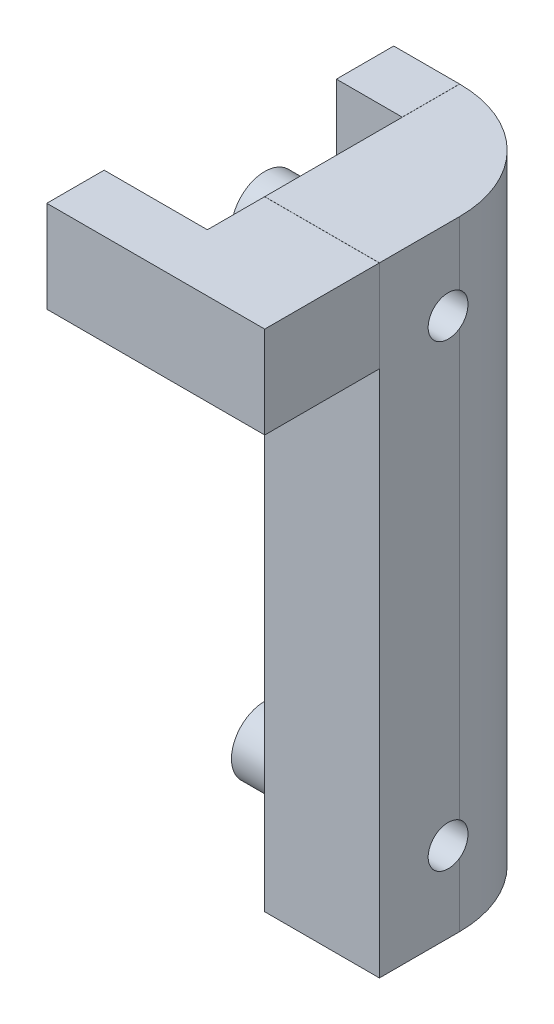
from build123d import *

# Parameters (mm, degrees)
SKETCH1_W               = 12
SKETCH1_H               = 54
BOSS_EXTRUDE1_DEPTH     = 10
SKETCH2_R               = 2.9
BOSS_EXTRUDE2_DEPTH     = 18
SKETCH3_W               = 12
SKETCH3_H               = 54
BOSS_EXTRUDE3_DEPTH     = 10
SKETCH4_R               = 1.75
CUT_EXTRUDE1_DEPTH      = 50
SKETCH5_W               = 38
SKETCH5_H               = 54
BOSS_EXTRUDE4_DEPTH     = 5
FILLET1_R               = 10
SKETCH6_W               = 6
SKETCH6_H               = 54
CUT_EXTRUDE2_DEPTH      = 15
SKETCH7_W               = 0.01
SKETCH7_H               = 54
CUT_EXTRUDE3_DEPTH      = 12.5
BOSS_EXTRUDE5_DEPTH     = 8
SKETCH9_W               = 38
SKETCH9_H               = 0.01
CUT_EXTRUDE4_DEPTH      = 50
SKETCH10_W              = 11
SKETCH10_H              = 54
BOSS_EXTRUDE6_DEPTH     = 2.5
BOSS_EXTRUDE7_DEPTH     = 54
CUT_EXTRUDE5_DEPTH      = 10
CUT_EXTRUDE5_DEPTH_BACK = 5
CUT_EXTRUDE6_DEPTH      = 67.550732692
CUT_EXTRUDE6_DEPTH_BACK = 67.550732692
SKETCH15_W              = 34.984132004
SKETCH15_H              = 56.27391211
SKETCH16_R              = 1
BOSS_EXTRUDE8_DEPTH     = 1.5


with BuildPart() as part:
    # Sketch1 → Boss-Extrude1 (new body)
    with BuildSketch(Plane(origin=(0, 0, 0), x_dir=(0, 0, -1), z_dir=(1, 0, 0))):
        with Locations((6, 27)):
            Rectangle(SKETCH1_W, SKETCH1_H)
    extrude(amount=BOSS_EXTRUDE1_DEPTH)

    # Sketch2 → Boss-Extrude2 (add)
    with BuildSketch(Plane.ZY):
        with Locations((-6, 47)):
            Circle(SKETCH2_R)
        with Locations((-6, 7)):
            Circle(SKETCH2_R)
    extrude(amount=BOSS_EXTRUDE2_DEPTH)

    # Sketch3 → Boss-Extrude3 (add)
    with BuildSketch(Plane.ZY.offset(18)):
        with Locations((-6, 27)):
            Rectangle(SKETCH3_W, SKETCH3_H)
    extrude(amount=BOSS_EXTRUDE3_DEPTH)

    # Sketch4 → Cut-Extrude1 (cut)
    with BuildSketch(Plane(origin=(10, 0, 0), x_dir=(0, 0, -1), z_dir=(1, 0, 0))):
        with Locations((6, 47)):
            Circle(SKETCH4_R)
        with Locations((6, 7)):
            Circle(SKETCH4_R)
    extrude(amount=-CUT_EXTRUDE1_DEPTH, mode=Mode.SUBTRACT)

    # Sketch5 → Boss-Extrude4 (add)
    with BuildSketch(Plane(origin=(0, 0, -12), x_dir=(-1, 0, 0), z_dir=(0, 0, -1))):
        with Locations((9, 27)):
            Rectangle(SKETCH5_W, SKETCH5_H)
    extrude(amount=BOSS_EXTRUDE4_DEPTH)

    # Fillet1
    # the kernel refuses this fillet: 10 mm, written as the material it takes off along each edge
    with BuildSketch(Plane(origin=(10, -25, -17), x_dir=(-1, 0, 0), z_dir=(0, 1, 0))) as fillet1_piece_1:
        with BuildLine():
            CenterArc((FILLET1_R, FILLET1_R), FILLET1_R, 180, 90)
            Line((0, FILLET1_R), (0, 0))
            Line((0, 0), (FILLET1_R, 0))
        make_face()
    extrude(amount=104, mode=Mode.SUBTRACT)
    with BuildSketch(Plane(origin=(-28, 79, -17), x_dir=(0, 0, 1), z_dir=(0, -1, 0))) as fillet1_piece_2:
        with BuildLine():
            CenterArc((FILLET1_R, -FILLET1_R), FILLET1_R, 90, 90)
            Line((0, -FILLET1_R), (0, 0))
            Line((0, 0), (FILLET1_R, 0))
        make_face()
    extrude(amount=104, mode=Mode.SUBTRACT)

    # Sketch6 → Cut-Extrude2 (cut)
    with BuildSketch(Plane.XY.offset(-12)):
        with Locations((-9, 27)):
            Rectangle(SKETCH6_W, SKETCH6_H)
    extrude(amount=CUT_EXTRUDE2_DEPTH, mode=Mode.SUBTRACT)

    # Sketch7 → Cut-Extrude3 (cut)
    with BuildSketch(Plane.XY.offset(-12)):
        with Locations((-17.995, 27)):
            Rectangle(SKETCH7_W, SKETCH7_H)
        with Locations((-0.005, 27)):
            Rectangle(SKETCH7_W, SKETCH7_H)
    extrude(amount=-CUT_EXTRUDE3_DEPTH, mode=Mode.SUBTRACT)


with BuildPart() as cut_extrude3_piece_1:
    # of the separate pieces the step leaves, piece 1, a body of its own (cut_extrude3_pieces)
    add(part.part.solids().sort_by_distance((-18, 0, 0))[0])



with BuildPart() as cut_extrude3_piece_2:
    # of the separate pieces the step leaves, piece 2, a body of its own (cut_extrude3_pieces)
    add(part.part.solids().sort_by_distance((0, 0, -17))[0])


with BuildPart() as cut_extrude3_piece_3:
    # of the separate pieces the step leaves, piece 3, a body of its own (cut_extrude3_pieces)
    add(part.part.solids().sort_by_distance((-17.99, 0, -12))[0])



with BuildPart() as cut_extrude3_piece_1_1:
    add(cut_extrude3_piece_1.part)

    add(cut_extrude3_piece_2.part)  # Boss-Extrude5 merges Cut-Extrude3 piece 2
    # Sketch8 → Boss-Extrude5 (add)
    with BuildSketch(Plane(origin=(0, 54, 0), x_dir=(1, 0, 0), z_dir=(0, 1, 0))):
        Polygon((-18, 0), (-18, -5), (0, -5), (0, 0), (10, 0), (10, -10), (-28, -10), (-28, 0), align=None)
    extrude(amount=-BOSS_EXTRUDE5_DEPTH)

    # Sketch9 → Cut-Extrude4 (cut)
    with BuildSketch(Plane.XZ.offset(-46)):
        with Locations((-9, 0.005)):
            Rectangle(SKETCH9_W, SKETCH9_H)
    extrude(amount=-CUT_EXTRUDE4_DEPTH, mode=Mode.SUBTRACT)


with BuildPart() as cut_extrude4_piece_1:
    # of the separate pieces the step leaves, piece 1, a body of its own (cut_extrude4_pieces)
    add(cut_extrude3_piece_1_1.part.solids().sort_by_distance((0, 0, -17))[0])


with BuildPart() as cut_extrude4_piece_2:
    # of the separate pieces the step leaves, piece 2, a body of its own (cut_extrude4_pieces)
    add(cut_extrude3_piece_1_1.part.solids().sort_by_distance((-18, 0, 0))[0])


with BuildPart() as cut_extrude4_piece_3:
    # of the separate pieces the step leaves, piece 3, a body of its own (cut_extrude4_pieces)
    add(cut_extrude3_piece_1_1.part.solids().sort_by_distance((0, 54, 0.01))[0])


with BuildPart() as cut_extrude3_piece_3_1:
    add(cut_extrude3_piece_3.part)

    add(cut_extrude4_piece_2.part)  # Boss-Extrude6 merges Cut-Extrude4 piece 2
    # Sketch10 → Boss-Extrude6 (add)
    with BuildSketch(Plane(origin=(0, 0, -17), x_dir=(-1, 0, 0), z_dir=(0, 0, -1))):
        with Locations((12.5, 27)):
            Rectangle(SKETCH10_W, SKETCH10_H)
    extrude(amount=BOSS_EXTRUDE6_DEPTH)

    # Sketch11 → Boss-Extrude7 (add)
    with BuildSketch(Plane(origin=(0, 54, 0), x_dir=(1, 0, 0), z_dir=(0, 1, 0))):
        Polygon((-18, 18.25), (-19.25, 19.5), (-18, 19.5), align=None)
        Polygon((-7, 19.5), (-7, 18.25), (-5.75, 19.5), align=None)
    extrude(amount=-BOSS_EXTRUDE7_DEPTH)

    # Sketch13 → Cut-Extrude5 (cut, two sides: drawn at the far end of the back side and taken through both)
    with BuildSketch(Plane(origin=(0, 0, -17), x_dir=(-1, 0, 0), z_dir=(0, 0, -1)).offset(-CUT_EXTRUDE5_DEPTH_BACK)):
        Polygon((34.299684683, 54), (7, 54), (7, 0), (5.75, 0), (5.75, -4.476290179), (34.299684683, -4.476290179), align=None)
        Polygon((7, 54), (5.75, 54), (5.75, 39), (4.75, 39), (4.412537726, 42.985739481), (2.412537726, 42.985739481), (0.01, 34.037246006), (0.01, 19.962753994), (2.412537726, 11.014260519), (4.412537726, 11.014260519), (4.75, 15), (5.75, 15), (5.75, 0), (7, 0), align=None)
    extrude(amount=CUT_EXTRUDE5_DEPTH + CUT_EXTRUDE5_DEPTH_BACK, mode=Mode.SUBTRACT)


with BuildPart() as cut_extrude6_tool:
    # Sketch15 → Cut-Extrude6 (new, two sides: drawn at the far end of the back side and taken through both)
    with BuildSketch(Plane.XY.offset(10).offset(-CUT_EXTRUDE6_DEPTH_BACK)):
        with Locations((-26.492066002, 25.863043945)):
            Rectangle(SKETCH15_W, SKETCH15_H)
    extrude(amount=CUT_EXTRUDE6_DEPTH + CUT_EXTRUDE6_DEPTH_BACK)


with BuildPart() as cut_extrude3_piece_3_2:
    add(cut_extrude3_piece_3_1.part)

    # Cut-Extrude6: cut by cut_extrude6_tool
    add(cut_extrude6_tool.part, mode=Mode.SUBTRACT)


with BuildPart() as cut_extrude4_piece_3_1:
    add(cut_extrude4_piece_3.part)

    # Cut-Extrude6: cut by cut_extrude6_tool
    add(cut_extrude6_tool.part, mode=Mode.SUBTRACT)

    # Sketch16 → Boss-Extrude8 (add)
    with BuildSketch(Plane.ZY.offset(9)):
        with Locations((7.5, 50)):
            Circle(SKETCH16_R)
    extrude(amount=BOSS_EXTRUDE8_DEPTH)


solid = Compound([cut_extrude4_piece_1.part, cut_extrude3_piece_3_2.part, cut_extrude4_piece_3_1.part])
